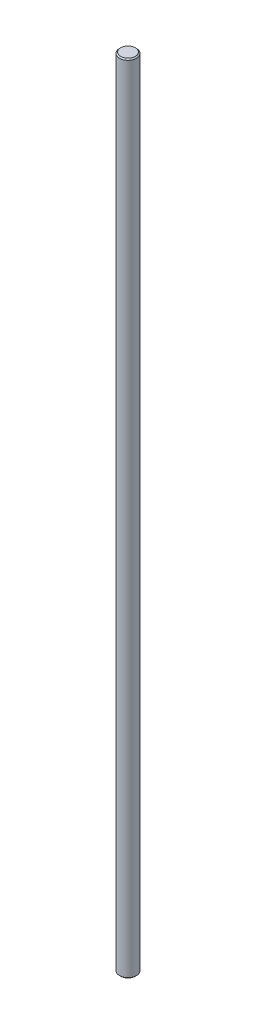
from build123d import *

# Parameters (mm, degrees)
SKETCH1_R           = 7.5
BOSS_EXTRUDE1_DEPTH = 700
CHAMFER1_SIZE       = 1


with BuildPart() as part:
    # Sketch1 → Boss-Extrude1 (new body)
    with BuildSketch(Plane(origin=(0, 0, 0), x_dir=(1, 0, 0), z_dir=(0, 1, 0))):
        Circle(SKETCH1_R)
    extrude(amount=BOSS_EXTRUDE1_DEPTH)

    # Chamfer1
    chamfer1_edges = [part.edges().sort_by_distance(p)[0] for p in [
        (-7.5, 700, 0),
        (-7.5, 0, 0),
    ]]
    chamfer(chamfer1_edges, length=CHAMFER1_SIZE)


solid = part.part
